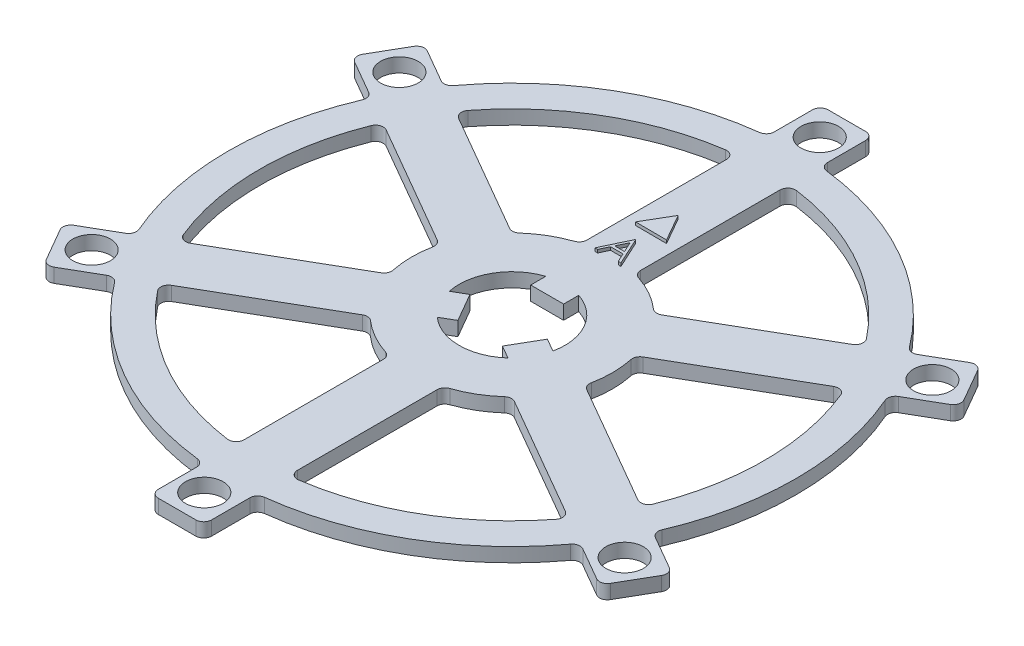
from build123d import *

# Parameters (mm, degrees)
SKETCH1_R           = 2.4
BOSS_EXTRUDE1_DEPTH = 1.8
BOSS_EXTRUDE2_DEPTH = 0.4
FILLET1_R           = 1
BOSS_EXTRUDE3_DEPTH = 0.4
SCALE1_SCALE        = 1.15


with BuildPart() as part:
    # Sketch1 → Boss-Extrude1 (new body)
    with BuildSketch(Plane(origin=(0, 0, 0), x_dir=(1, 0, 0), z_dir=(0, 1, 0))):
        with BuildLine():
            Line((3.292416453, 36.059862473), (3.292416453, 42.820504357))
            Line((3.292416453, 42.820504357), (-3.487887898, 42.820504357))
            Line((-3.487887898, 42.820504357), (-3.487887898, 36.041480626))
            ThreePointArc((-3.487887898, 36.041480626), (-18.189876626, 31.309456655), (-29.582548732, 20.881247525))
            Line((-29.582548732, 20.881247525), (-35.43743635, 24.261568467))
            Line((-35.43743635, 24.261568467), (-38.827588525, 18.389652653))
            Line((-38.827588525, 18.389652653), (-32.956781761, 15.000140788))
            ThreePointArc((-32.956781761, 15.000140788), (-36.209723155, -0.098166922), (-32.874965185, -15.178614948))
            Line((-32.874965185, -15.178614948), (-38.729852803, -18.55893589))
            Line((-38.729852803, -18.55893589), (-35.339700627, -24.430851704))
            Line((-35.339700627, -24.430851704), (-29.468893863, -21.041339838))
            ThreePointArc((-29.468893863, -21.041339838), (-18.019846529, -31.407623577), (-3.292416453, -36.059862473))
            Line((-3.292416453, -36.059862473), (-3.292416453, -42.820504357))
            Line((-3.292416453, -42.820504357), (3.487887898, -42.820504357))
            Line((3.487887898, -42.820504357), (3.487887898, -36.041480626))
            ThreePointArc((3.487887898, -36.041480626), (18.189876626, -31.309456655), (29.582548732, -20.881247525))
            Line((29.582548732, -20.881247525), (35.43743635, -24.261568467))
            Line((35.43743635, -24.261568467), (38.827588525, -18.389652653))
            Line((38.827588525, -18.389652653), (32.956781761, -15.000140788))
            ThreePointArc((32.956781761, -15.000140788), (36.209723155, 0.098166922), (32.874965185, 15.178614948))
            Line((32.874965185, 15.178614948), (38.729852803, 18.55893589))
            Line((38.729852803, 18.55893589), (35.339700627, 24.430851704))
            Line((35.339700627, 24.430851704), (29.468893863, 21.041339838))
            ThreePointArc((29.468893863, 21.041339838), (18.019846529, 31.407623577), (3.292416453, 36.059862473))
        make_face()
        with Locations((0, 39.259818305)):
            Circle(SKETCH1_R, mode=Mode.SUBTRACT)
        with Locations((34, 19.629909152)):
            Circle(SKETCH1_R, mode=Mode.SUBTRACT)
        with Locations((34, -19.629909152)):
            Circle(SKETCH1_R, mode=Mode.SUBTRACT)
        with Locations((0, -39.259818305)):
            Circle(SKETCH1_R, mode=Mode.SUBTRACT)
        with Locations((-34, -19.629909152)):
            Circle(SKETCH1_R, mode=Mode.SUBTRACT)
        with Locations((-34, 19.629909152)):
            Circle(SKETCH1_R, mode=Mode.SUBTRACT)
        with BuildLine():
            Line((6.606243368, -1.385658169), (4.938012708, -0.422504748))
            Line((4.938012708, -0.422504748), (2.838012708, -4.059811444))
            Line((2.838012708, -4.059811444), (4.508004754, -5.023981801))
            ThreePointArc((4.508004754, -5.023981801), (0.003268724, -6.749999209), (-4.503136859, -5.028345496))
            Line((-4.503136859, -5.028345496), (-2.834906199, -4.065192075))
            Line((-2.834906199, -4.065192075), (-4.934906199, -0.427885379))
            Line((-4.934906199, -0.427885379), (-6.604898245, -1.392055737))
            ThreePointArc((-6.604898245, -1.392055737), (-5.847305152, 3.372168806), (-2.103106509, 6.414003665))
            Line((-2.103106509, 6.414003665), (-2.103106509, 4.487696823))
            Line((-2.103106509, 4.487696823), (2.096893491, 4.487696823))
            Line((2.096893491, 4.487696823), (2.096893491, 6.416037538))
            ThreePointArc((2.096893491, 6.416037538), (5.844036428, 3.377830402), (6.606243368, -1.385658169))
        make_face(mode=Mode.SUBTRACT)
        with BuildLine():
            Line((3.292416453, 12.36931663), (3.292416453, 32.021792033))
            ThreePointArc((3.292416453, 32.021792033), (16.010113467, 27.926894527), (25.969813588, 19.0211449))
            Line((25.969813588, 19.0211449), (8.921700828, 9.178412408))
            ThreePointArc((8.921700828, 9.178412408), (6.312022867, 11.135455416), (3.292416453, 12.36931663))
        make_face(mode=Mode.SUBTRACT)
        with BuildLine():
            Line((-3.487887898, 12.315625766), (-3.487887898, 32.001090749))
            ThreePointArc((-3.487887898, 32.001090749), (-16.180343375, 27.828612243), (-26.085477149, 18.862212305))
            Line((-26.085477149, 18.862212305), (-9.065934203, 9.035974603))
            ThreePointArc((-9.065934203, 9.035974603), (-6.487575839, 11.03409986), (-3.487887898, 12.315625766))
        make_face(mode=Mode.SUBTRACT)
        with BuildLine():
            Line((12.358350656, 3.333342027), (29.377893602, 13.159579728))
            ThreePointArc((29.377893602, 13.159579728), (32.190456842, 0.098282284), (29.457701487, -12.979945849))
            Line((29.457701487, -12.979945849), (12.409588726, -3.137213358))
            ThreePointArc((12.409588726, -3.137213358), (12.799598707, 0.101355556), (12.358350656, 3.333342027))
        make_face(mode=Mode.SUBTRACT)
        with BuildLine():
            Line((9.065934203, -9.035974603), (26.085477149, -18.862212305))
            ThreePointArc((26.085477149, -18.862212305), (16.180343375, -27.828612243), (3.487887898, -32.001090749))
            Line((3.487887898, -32.001090749), (3.487887898, -12.315625766))
            ThreePointArc((3.487887898, -12.315625766), (6.487575839, -11.03409986), (9.065934203, -9.035974603))
        make_face(mode=Mode.SUBTRACT)
        with BuildLine():
            Line((-3.292416453, -12.36931663), (-3.292416453, -32.021792033))
            ThreePointArc((-3.292416453, -32.021792033), (-16.010113467, -27.926894527), (-25.969813588, -19.0211449))
            Line((-25.969813588, -19.0211449), (-8.921700828, -9.178412408))
            ThreePointArc((-8.921700828, -9.178412408), (-6.312022867, -11.135455416), (-3.292416453, -12.36931663))
        make_face(mode=Mode.SUBTRACT)
        with BuildLine():
            Line((-12.358350656, -3.333342027), (-29.377893602, -13.159579728))
            ThreePointArc((-29.377893602, -13.159579728), (-32.190456842, -0.098282284), (-29.457701487, 12.979945849))
            Line((-29.457701487, 12.979945849), (-12.409588726, 3.137213358))
            ThreePointArc((-12.409588726, 3.137213358), (-12.799598707, -0.101355556), (-12.358350656, -3.333342027))
        make_face(mode=Mode.SUBTRACT)
    extrude(amount=BOSS_EXTRUDE1_DEPTH)

    # Sketch3 → Boss-Extrude2 (add)
    # profile 1 of 2: a face of its own
    with BuildSketch(Plane(origin=(0, 1.2, 0), x_dir=(1, 0, 0), z_dir=(0, 1, 0))):
        Polygon((0, 21.29720867), (-1.469825824, 18.751395665), (1.469825824, 18.751395665), align=None)
    # profile 2 of 2: a face of its own
    with BuildSketch(Plane(origin=(0, 1.2, 0), x_dir=(1, 0, 0), z_dir=(0, 1, 0))):
        Polygon((-0.052863928, 17.885283777), (1.562520688, 14.385283777), (1.221074374, 14.385283777), (0.703646489, 15.507078649), (-0.882992133, 15.507078649), (-1.415143575, 14.385283777), (-1.757992133, 14.385283777), (-0.097735723, 17.885283777), align=None)
        Polygon((-0.078805434, 17.20309227), (-0.712619537, 15.866053008), (0.538181745, 15.866053008), align=None, mode=Mode.SUBTRACT)
    extrude(amount=BOSS_EXTRUDE2_DEPTH)

    # Fillet1
    fillet1_edges = [part.edges().sort_by_distance(p)[0] for p in [
        (29.468893863, 0.9, -21.041339838),
        (3.292416453, 0.9, -32.021792033),
        (25.969813588, 0.9, -19.0211449),
        (29.377893602, 0.9, -13.159579728),
        (29.457701487, 0.9, 12.979945849),
        (35.339700627, 0.9, -24.430851704),
        (38.729852803, 0.9, -18.55893589),
        (32.874965185, 0.9, -15.178614948),
        (38.827588525, 0.9, 18.389652653),
        (32.956781761, 0.9, 15.000140788),
        (12.358350656, 0.9, -3.333342027),
        (12.409588726, 0.9, 3.137213358),
        (26.085477149, 0.9, 18.862212305),
        (3.487887898, 0.9, 32.001090749),
        (35.43743635, 0.9, 24.261568467),
        (29.582548732, 0.9, 20.881247525),
        (9.065934203, 0.9, 9.035974603),
        (3.487887898, 0.9, 12.315625766),
        (3.487887898, 0.9, 36.041480626),
        (3.487887898, 0.9, 42.820504357),
        (-3.292416453, 0.9, 42.820504357),
        (-3.292416453, 0.9, 36.059862473),
        (-3.292416453, 0.9, 32.021792033),
        (-8.921700828, 0.9, 9.178412408),
        (-3.292416453, 0.9, 12.36931663),
        (-25.969813588, 0.9, 19.0211449),
        (-29.468893863, 0.9, 21.041339838),
        (-35.339700627, 0.9, 24.430851704),
        (-38.729852803, 0.9, 18.55893589),
        (-32.874965185, 0.9, 15.178614948),
        (-29.377893602, 0.9, 13.159579728),
        (-29.457701487, 0.9, -12.979945849),
        (-12.358350656, 0.9, 3.333342027),
        (-12.409588726, 0.9, -3.137213358),
        (-32.956781761, 0.9, -15.000140788),
        (-38.827588525, 0.9, -18.389652653),
        (8.921700828, 0.9, -9.178412408),
        (-35.43743635, 0.9, -24.261568467),
        (3.292416453, 0.9, -36.059862473),
        (3.292416453, 0.9, -42.820504357),
        (3.292416453, 0.9, -12.36931663),
        (-26.085477149, 0.9, -18.862212305),
        (-3.487887898, 0.9, -36.041480626),
        (-29.582548732, 0.9, -20.881247525),
        (-3.487887898, 0.9, -12.315625766),
        (-9.065934203, 0.9, -9.035974603),
        (-3.487887898, 0.9, -42.820504357),
        (-3.487887898, 0.9, -32.001090749),
    ]]
    fillet(fillet1_edges, radius=FILLET1_R)

    # Sketch4 → Boss-Extrude3 (add)
    # profile 1 of 2: a face of its own
    with BuildSketch(Plane(origin=(0, 1.8, 0), x_dir=(1, 0, 0), z_dir=(0, 1, 0))):
        Polygon((0.010960332, 21.186568712), (-1.99146253, 17.756238281), (1.980502198, 17.73725443), align=None)
    # profile 2 of 2: a face of its own
    with BuildSketch(Plane(origin=(0, 1.8, 0), x_dir=(1, 0, 0), z_dir=(0, 1, 0))):
        Polygon((-0.0107219, 15.792389726), (1.604662715, 12.292389726), (1.263216401, 12.292389726), (0.745788516, 13.414184597), (-0.840850106, 13.414184597), (-1.373001548, 12.292389726), (-1.715850106, 12.292389726), (-0.055593695, 15.792389726), align=None)
        Polygon((-0.036663407, 15.110198219), (-0.670477509, 13.773158956), (0.580323773, 13.773158956), align=None, mode=Mode.SUBTRACT)
    extrude(amount=BOSS_EXTRUDE3_DEPTH)


with BuildPart() as part_1:
    # Scale1: scaled about (-1.2533e-05, 0.901046106, -0.016609763)
    add(part.part.scale(SCALE1_SCALE).moved(Location((1.88e-06, -0.135156916, 0.002491464))))


solid = part_1.part
